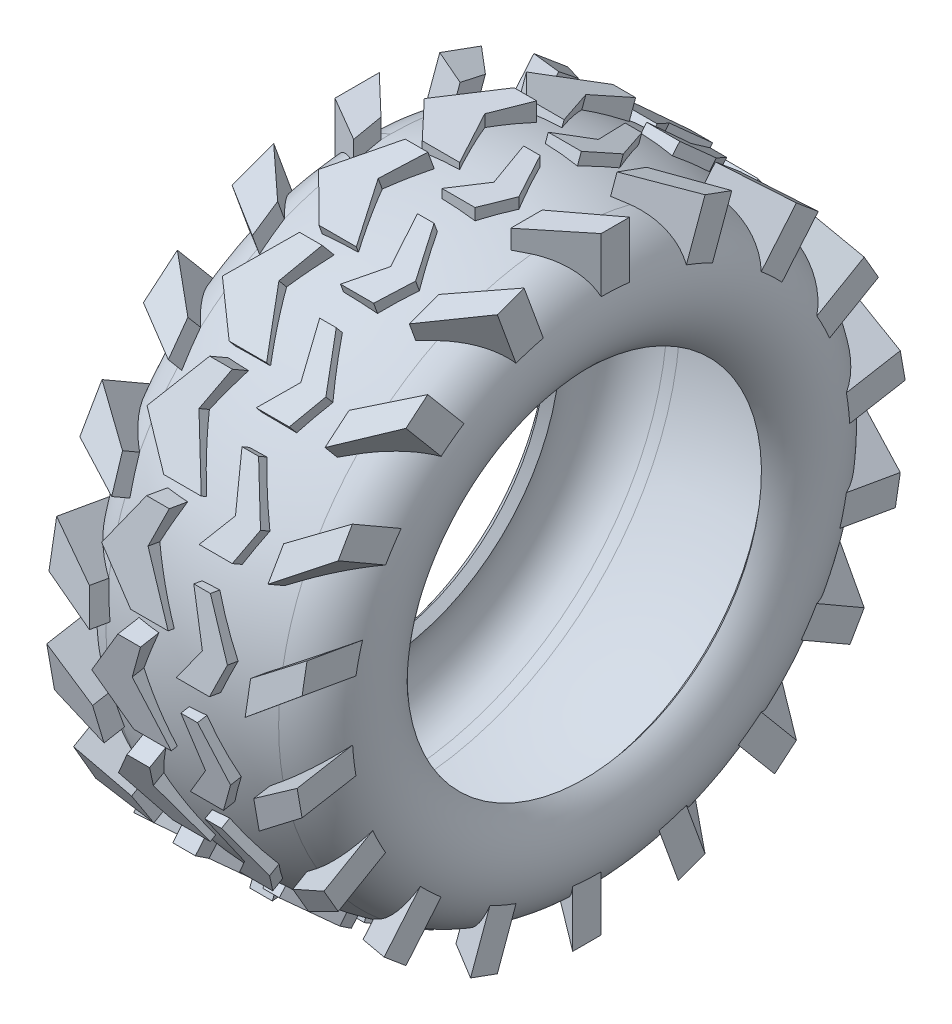
from build123d import *

# Parameters (mm, degrees)
BOSS_EXTRUDE1_REACH = 137.03
CIRPATTERN1_COUNT   = 18


with BuildPart() as part:
    # Sketch1 → Revolve2 (revolve)
    with BuildSketch(Plane.XY):
        with BuildLine():
            Line((-21.301113599, 35), (-20, 36.518915206))
            ThreePointArc((-20, 36.518915206), (-23.414389456, 46.417378094), (-16.443643274, 54.230592579))
            Line((-16.443643274, 54.230592579), (-14.5290736, 54.808885726))
            ThreePointArc((-14.5290736, 54.808885726), (-7.333585344, 56.312483742), (0, 56.816848944))
            ThreePointArc((0, 56.816848944), (7.333585344, 56.312483742), (14.5290736, 54.808885726))
            Line((14.5290736, 54.808885726), (16.443643274, 54.230592579))
            ThreePointArc((16.443643274, 54.230592579), (23.414389456, 46.417378094), (20, 36.518915206))
            Line((20, 36.518915206), (21.301113599, 35))
            ThreePointArc((21.301113599, 35), (25.375251721, 46.811102842), (17.057576445, 56.134033165))
            ThreePointArc((17.057576445, 56.134033165), (8.633632125, 58.14204772), (0, 58.816848944))
            ThreePointArc((0, 58.816848944), (-8.633632125, 58.14204772), (-17.057576445, 56.134033165))
            ThreePointArc((-17.057576445, 56.134033165), (-25.375251721, 46.811102842), (-21.301113599, 35))
        make_face()
    revolve(axis=Axis((0, 0, 0), (-1, 0, 0)))

    # Sketch3 → Boss-Extrude1 (add, up to next)
    with BuildSketch(Plane(origin=(0, 60, 0), x_dir=(1, 0, 0), z_dir=(0, 1, 0)), mode=Mode.PRIVATE) as boss_extrude1_sk1:
        Polygon((-24.818658645, -3.142459321), (-24.818658645, 5.621641141), (-17.057576445, -1.801737719), (-15.930397567, -8.326677661), align=None)
    boss_extrude1_tool1 = extrude(boss_extrude1_sk1.sketch, amount=-BOSS_EXTRUDE1_REACH, mode=Mode.PRIVATE) - part.part
    # Sketch3 → Boss-Extrude1 (add, up to next)
    with BuildSketch(Plane(origin=(0, 60, 0), x_dir=(1, 0, 0), z_dir=(0, 1, 0)), mode=Mode.PRIVATE) as boss_extrude1_sk2:
        Polygon((14.783907043, -8.006321017), (14.783907043, -1.801737719), (24.641994252, 5.621641141), (24.641994252, 0), align=None)
    boss_extrude1_tool2 = extrude(boss_extrude1_sk2.sketch, amount=-BOSS_EXTRUDE1_REACH, mode=Mode.PRIVATE) - part.part
    # Sketch3 → Boss-Extrude1 (add, up to next)
    with BuildSketch(Plane(origin=(0, 60, 0), x_dir=(1, 0, 0), z_dir=(0, 1, 0)), mode=Mode.PRIVATE) as boss_extrude1_sk3:
        Polygon((10.198312899, -1.801737719), (5.255820402, 7.335576072), (1.977637264, 7.335576072), (5.255820402, -1.801737719), (1.19087331, -8.006321017), (7.727066651, -8.006321017), align=None)
    boss_extrude1_tool3 = extrude(boss_extrude1_sk3.sketch, amount=-BOSS_EXTRUDE1_REACH, mode=Mode.PRIVATE) - part.part
    # Sketch3 → Boss-Extrude1 (add, up to next)
    with BuildSketch(Plane(origin=(0, 60, 0), x_dir=(1, 0, 0), z_dir=(0, 1, 0)), mode=Mode.PRIVATE) as boss_extrude1_sk4:
        Polygon((-1.511875157, -1.801737719), (-7.357490134, 9.005201977), (-4.434682645, 16.343524712), (-8.905930757, 16.343524712), (-15.930397567, 5.621641141), (-8.905930757, -1.801737719), align=None)
    boss_extrude1_tool4 = extrude(boss_extrude1_sk4.sketch, amount=-BOSS_EXTRUDE1_REACH, mode=Mode.PRIVATE) - part.part
    boss_extrude1_1 = boss_extrude1_tool1.solids().sort_by_distance((-20.945852, 60, 1.791954))[0]
    add(boss_extrude1_1)
    boss_extrude1_2 = boss_extrude1_tool2.solids().sort_by_distance((19.631963, 60, 1.109985))[0]
    add(boss_extrude1_2)
    boss_extrude1_3 = boss_extrude1_tool3.solids().sort_by_distance((5.911241, 60, 1.194618))[0]
    add(boss_extrude1_3)
    boss_extrude1_4 = boss_extrude1_tool4.solids().sort_by_distance((-8.831075, 60, -6.251347))[0]
    add(boss_extrude1_4)
    boss_extrude1 = boss_extrude1_1 + boss_extrude1_2 + boss_extrude1_3 + boss_extrude1_4  # Boss-Extrude1 as one shape, for the pattern or mirror that repeats it

    # CirPattern1: Boss-Extrude1 ×18 about axis
    cirpattern1_axis = Axis((21.301113599, 0, 0), (1, 0, 0))
    for i in range(1, CIRPATTERN1_COUNT):
        add(boss_extrude1.rotate(cirpattern1_axis, i * 360 / CIRPATTERN1_COUNT))


solid = part.part
